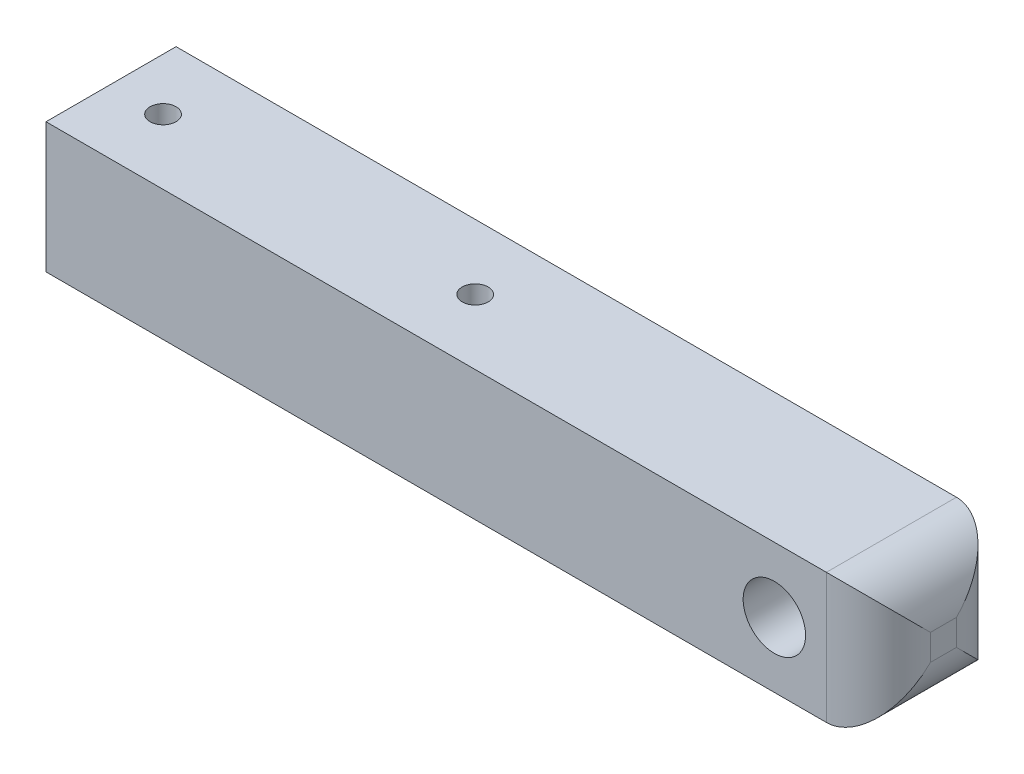
from build123d import *

# Parameters (mm, degrees)
BOSS_EXTRUDE1_DEPTH         = 15.875
CUT_EXTRUDE1_DEPTH          = 152.4
F_1_2_0_5_DIAMETER_HOLE1_D  = 15.24
F_1_4_0_25_DIAMETER_HOLE1_D = 6.35
FILLET1_R                   = 12.7


with BuildPart() as part:
    # Sketch1 → Boss-Extrude1 (new, symmetric)
    with BuildSketch(Plane.XY):
        Polygon((0, 0), (101.6, 0), (101.6, 31.75), (-101.6, 31.75), (-101.6, 0), align=None)
    extrude(amount=BOSS_EXTRUDE1_DEPTH, both=True)

    # Sketch2 → Cut-Extrude1 (cut)
    with BuildSketch(Plane.ZY.offset(101.6)):
        Polygon((0, 4.971051224), (-8.980256121, 13.951307345), (-9.878281733, 13.053281733), (0, 3.175), (9.878281733, 13.053281733), (8.980256121, 13.951307345), align=None)
    extrude(amount=-CUT_EXTRUDE1_DEPTH, mode=Mode.SUBTRACT)

    # 1/2 (0.5) Diameter Hole1 (through all)
    with Locations(Plane.XY.offset(15.875)):
        with Locations((76.2, 15.875)):
            Hole(F_1_2_0_5_DIAMETER_HOLE1_D / 2)

    # 1/4 (0.25) Diameter Hole1 (through all)
    with Locations(Plane(origin=(0, 31.75, 0), x_dir=(1, 0, 0), z_dir=(0, 1, 0))):
        with Locations((-88.9, 0), (-12.7, 0)):
            Hole(F_1_4_0_25_DIAMETER_HOLE1_D / 2)

    # Fillet1
    fillet1_edges = [part.edges().sort_by_distance(p)[0] for p in [
        (101.6, 0, 0),
        (101.6, 15.875, -15.875),
        (101.6, 31.75, 0),
        (101.6, 15.875, 15.875),
    ]]
    fillet(fillet1_edges, radius=FILLET1_R)


solid = part.part
